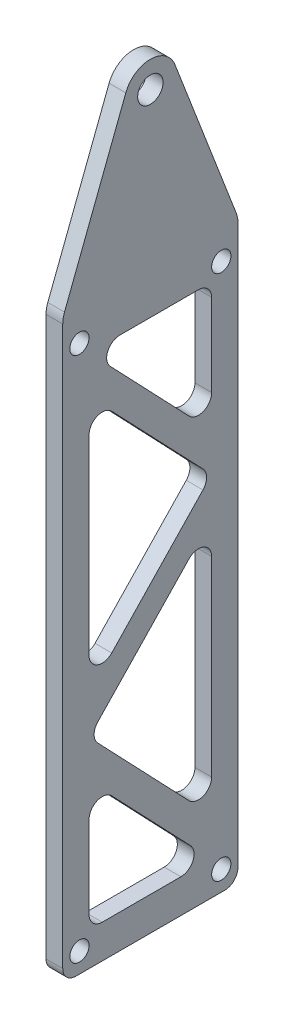
from build123d import *

# Parameters (mm, degrees)
SKETCH1_R           = 1.8288
SKETCH1_R_2         = 2.413
BOSS_EXTRUDE1_DEPTH = 3.175
SKETCH2_W           = 4.112404804
SKETCH2_H           = 141.223
CUT_EXTRUDE1_DEPTH  = 106.912542124
FILLET1_R           = 2.5
FILLET2_R           = 5


with BuildPart() as part:
    # Sketch1 → Boss-Extrude1 (new body)
    with BuildSketch(Plane(origin=(0, 0, 0), x_dir=(0, 0, -1), z_dir=(1, 0, 0))):
        Polygon((20.757404804, -103.81), (20.757404804, -5), (0, 48.916537522), (-20.757404804, -5), (-20.757404804, -103.81), align=None)
        with Locations((-13.4747, -100)):
            Circle(SKETCH1_R, mode=Mode.SUBTRACT)
        with Locations((13.4747, -100)):
            Circle(SKETCH1_R, mode=Mode.SUBTRACT)
        with Locations((0, 35)):
            Circle(SKETCH1_R_2, mode=Mode.SUBTRACT)
        with Locations((-13.4747, 0)):
            Circle(SKETCH1_R, mode=Mode.SUBTRACT)
        with Locations((13.4747, 0)):
            Circle(SKETCH1_R, mode=Mode.SUBTRACT)
    extrude(amount=BOSS_EXTRUDE1_DEPTH)

    # Sketch2 → Cut-Extrude1 (cut, through all)
    with BuildSketch(Plane(origin=(3.175, 0, 0), x_dir=(0, 0, -1), z_dir=(1, 0, 0))):
        Polygon((11.645, -2.5), (-11.645, -2.5), (11.645, -26.898674048), align=None)
        Polygon((-11.645, -9.741325952), (11.645, -34.14), (-11.645, -58.538674048), (-11.645, -34.14), align=None)
        Polygon((-11.645, -73.021325952), (-11.645, -97.42), (11.645, -97.42), align=None)
        Polygon((11.645, -41.381325952), (11.645, -65.78), (11.645, -90.178674048), (-11.645, -65.78), align=None)
        with Locations((-18.701202402, -33.1985)):
            Rectangle(SKETCH2_W, SKETCH2_H)
        with Locations((18.701202402, -33.1985)):
            Rectangle(SKETCH2_W, SKETCH2_H)
    extrude(amount=-CUT_EXTRUDE1_DEPTH, mode=Mode.SUBTRACT)

    # Fillet1
    fillet1_edges = [part.edges().sort_by_distance(p)[0] for p in [
        (1.5875, -97.42, -11.645),
        (1.5875, -90.178674048, -11.645),
        (1.5875, -41.381325952, -11.645),
        (1.5875, -73.021325952, 11.645),
        (1.5875, -97.42, 11.645),
        (1.5875, -65.78, 11.645),
        (1.5875, -58.538674048, 11.645),
        (1.5875, -34.14, -11.645),
        (1.5875, -9.741325952, 11.645),
        (1.5875, -2.5, 11.645),
        (1.5875, -26.898674048, -11.645),
        (1.5875, -2.5, -11.645),
        (1.5875, -103.81, 16.645),
        (1.5875, -103.81, -16.645),
    ]]
    fillet(fillet1_edges, radius=FILLET1_R)

    # Fillet2
    fillet2_edges = [part.edges().sort_by_distance(p)[0] for p in [
        (1.5875, 48.916537522, 0),
        (1.5875, 5.681808734, 16.645),
        (1.5875, 5.681808734, -16.645),
    ]]
    fillet(fillet2_edges, radius=FILLET2_R)


solid = part.part
